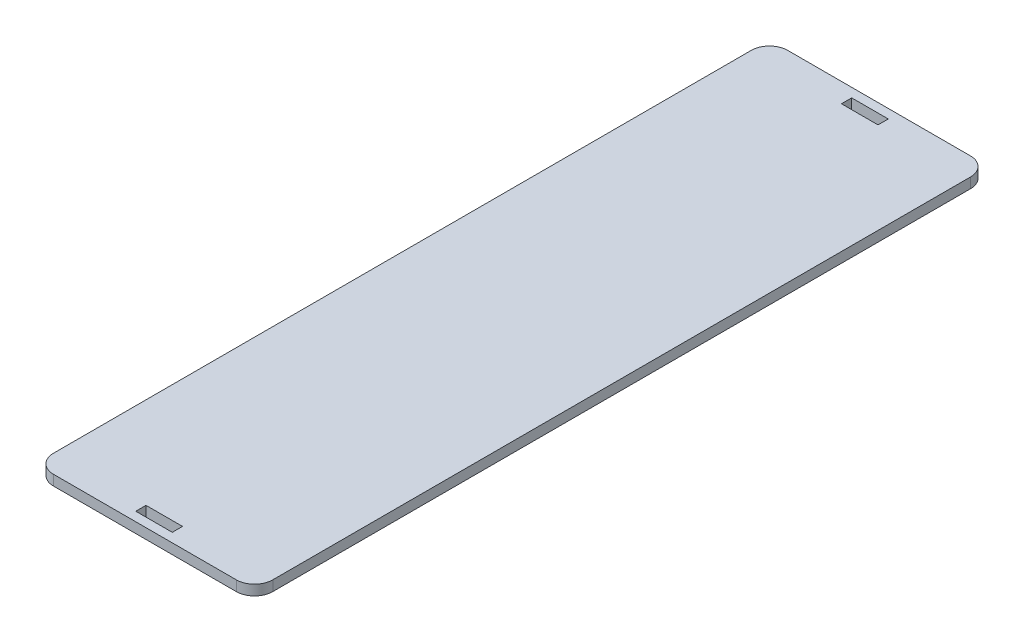
from build123d import *

# Parameters (mm, degrees)
SKETCH_1_W      = 120
SKETCH_1_H      = 401.8
SKETCH_1_W_2    = 20
SKETCH_1_H_2    = 5.6
EXTRUDE_1_DEPTH = 5.6
FILLET_1_R      = 10


with BuildPart() as part:
    # ｽｹｯﾁ1 → ﾎﾞｽ - 押し出し1 (new body)
    with BuildSketch(Plane(origin=(0, 0, 0), x_dir=(1, 0, 0), z_dir=(0, 1, 0))):
        Rectangle(SKETCH_1_W, SKETCH_1_H)
        with Locations((0, -193.1)):
            Rectangle(SKETCH_1_W_2, SKETCH_1_H_2, mode=Mode.SUBTRACT)
        with Locations((0, 193.1)):
            Rectangle(SKETCH_1_W_2, SKETCH_1_H_2, mode=Mode.SUBTRACT)
    extrude(amount=EXTRUDE_1_DEPTH)

    # ﾌｨﾚｯﾄ1
    fillet_1_edges = [part.edges().sort_by_distance(p)[0] for p in [
        (-60, 2.8, -200.9),
        (60, 2.8, -200.9),
        (60, 2.8, 200.9),
        (-60, 2.8, 200.9),
    ]]
    fillet(fillet_1_edges, radius=FILLET_1_R)


solid = part.part
